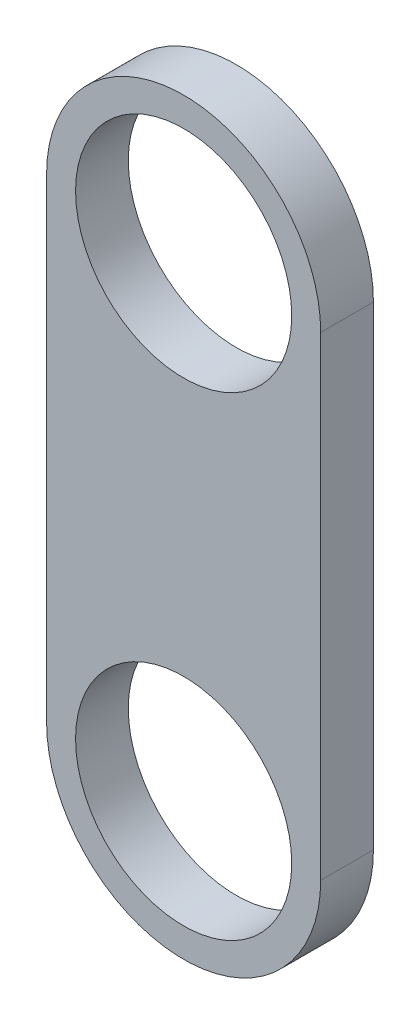
from build123d import *

# Parameters (mm, degrees)
SKETCH1_R           = 10.25
BOSS_EXTRUDE1_DEPTH = 5


with BuildPart() as part:
    # Sketch1 → Boss-Extrude1 (new body)
    with BuildSketch(Plane.XY):
        with BuildLine():
            Line((13, -45), (13, 0))
            ThreePointArc((13, 0), (0, 13), (-13, 0))
            Line((-13, 0), (-13, -45))
            ThreePointArc((-13, -45), (0, -58), (13, -45))
        make_face()
        with Locations((0, -45)):
            Circle(SKETCH1_R, mode=Mode.SUBTRACT)
        Circle(SKETCH1_R, mode=Mode.SUBTRACT)
    extrude(amount=BOSS_EXTRUDE1_DEPTH)


solid = part.part
